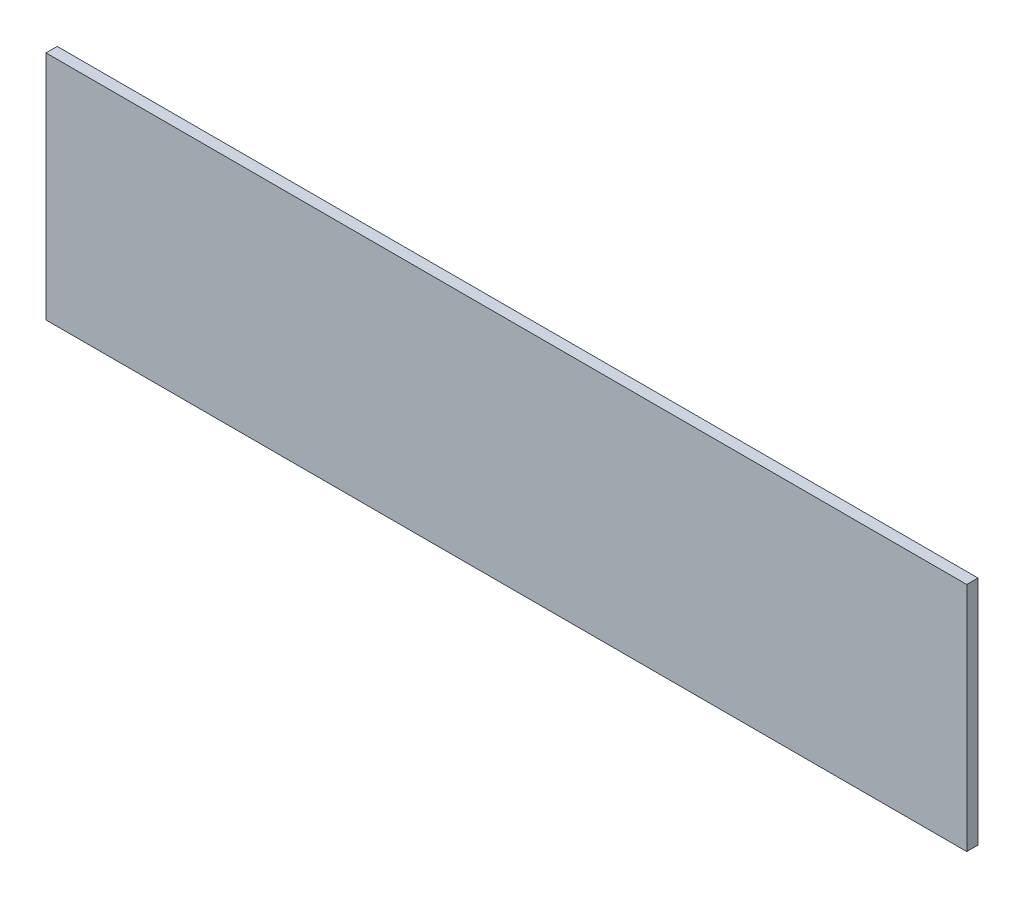
from build123d import *

# Parameters (mm, degrees)
SKETCH_1_W      = 410
SKETCH_1_H      = 103
EXTRUDE_1_DEPTH = 5


with BuildPart() as part:
    # 스케치1 → 보스-돌출1 (new body)
    with BuildSketch(Plane.XY):
        Rectangle(SKETCH_1_W, SKETCH_1_H)
    extrude(amount=EXTRUDE_1_DEPTH)


solid = part.part
